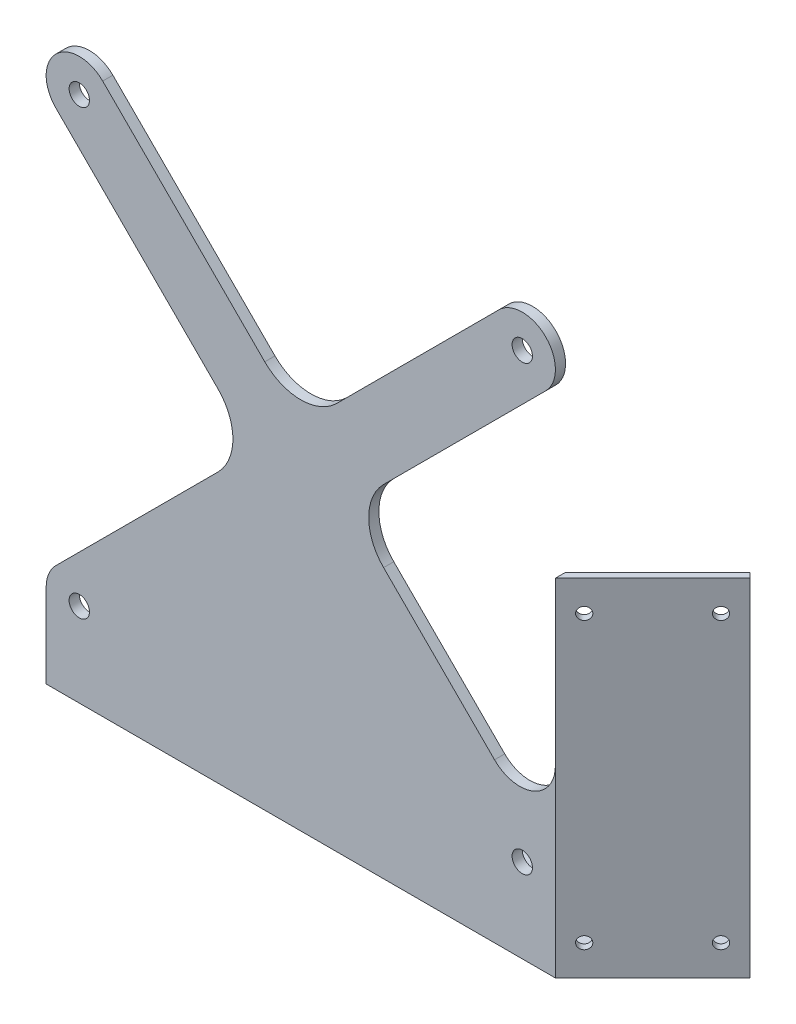
from build123d import *

# Parameters (mm, degrees)
ESQUISSE1_W                                 = 100
ESQUISSE1_H                                 = 110
BOSS_EXTRU_1_DEPTH                          = 2
ESQUISSE3_W                                 = 100
ESQUISSE3_H                                 = 20
BOSS_EXTRU_2_DEPTH                          = 3
ESQUISSE6_R                                 = 2
ENL_V_MAT_EXTRU_1_DEPTH                     = 78.517739905
ENL_V_MAT_EXTRU_2_DEPTH                     = 78.517739905
CONG_2_R                                    = 10
BOSS_EXTRU_3_DEPTH                          = 3
FRAISAGE_POUR_VIS_T_TE_FRAIS_E_M51_AT_COUNT = 2
FRAISAGE_POUR_VIS_T_TE_FRAIS_E_M51_AT_PITCH = 80
BOSS_EXTRU_4_DEPTH                          = 65
BOSS_EXTRU_5_DEPTH                          = 2
CONG_3_R                                    = 7
D_GAGEMENT_M21_D                            = 2.4
D_GAGEMENT_M21_ON_FACE_2_D                  = 2.4
CONG_1_R                                    = 2


with BuildPart() as part:
    # Esquisse1 → Boss.-Extru.1 (new body)
    with BuildSketch(Plane.XY):
        Rectangle(ESQUISSE1_W, ESQUISSE1_H)
    extrude(amount=BOSS_EXTRU_1_DEPTH)

    # Esquisse3 → Boss.-Extru.2 (add)
    with BuildSketch(Plane.XZ.offset(55)):
        with Locations((0, -10)):
            Rectangle(ESQUISSE3_W, ESQUISSE3_H)
    extrude(amount=-BOSS_EXTRU_2_DEPTH)

    # Esquisse6 → Enlèv. mat.-Extru.1 (cut, through all)
    with BuildSketch(Plane.XY.offset(2)):
        with Locations((-43.5, 48.5)):
            Circle(ESQUISSE6_R)
        with Locations((43.5, 48.5)):
            Circle(ESQUISSE6_R)
        with Locations((-43.5, -38.5)):
            Circle(ESQUISSE6_R)
        with Locations((43.5, -38.5)):
            Circle(ESQUISSE6_R)
    extrude(amount=-ENL_V_MAT_EXTRU_1_DEPTH, mode=Mode.SUBTRACT)

    # Esquisse7 → Enlèv. mat.-Extru.2 (cut, through all)
    with BuildSketch(Plane.XY.offset(2)):
        with BuildLine():
            Line((0, 55), (-43.500000007, 55))
            ThreePointArc((-43.500000007, 55), (-41.012557693, 54.505216963), (-38.903805922, 53.096194078))
            Line((-38.903805922, 53.096194078), (0, 14.192388155))
            Line((0, 14.192388155), (0, 55))
        make_face()
        with BuildLine():
            Line((-9.192388155, 5), (-48.096194078, 43.903805922))
            ThreePointArc((-48.096194078, 43.903805922), (-49.505216961, 46.01255769), (-50, 48.5))
            Line((-50, 48.5), (-50, -38.5))
            ThreePointArc((-50, -38.5), (-49.505216961, -36.01255769), (-48.096194078, -33.903805922))
            Line((-48.096194078, -33.903805922), (-9.192388155, 5))
        make_face()
        with BuildLine():
            Line((-50, 55), (-50, 48.5))
            ThreePointArc((-50, 48.5), (-48.09619408, 53.096194075), (-43.500000007, 55))
            Line((-43.500000007, 55), (-50, 55))
        make_face()
    enl_v_mat_extru_2 = extrude(amount=-ENL_V_MAT_EXTRU_2_DEPTH, mode=Mode.SUBTRACT)

    # Symétrie1: Enlèv. mat.-Extru.2 across plane
    add(enl_v_mat_extru_2.mirror(Plane(origin=(0, 0, 0), x_dir=(0, 0, 1), z_dir=(1, 0, 0))), mode=Mode.SUBTRACT)

    # Congé2
    cong_2_edges = [part.edges().sort_by_distance(p)[0] for p in [
        (9.192388155, 5, 1),
        (-9.192388155, 5, 1),
        (0, 14.192388155, 1),
    ]]
    fillet(cong_2_edges, radius=CONG_2_R)

    # Esquisse8 → Boss.-Extru.3 (add)
    with BuildSketch(Plane.XZ.offset(55)):
        Polygon((50, 2), (69.091883092, -17.091883092), (66.183766184, -20), (50, -20), align=None)
    extrude(amount=-BOSS_EXTRU_3_DEPTH)

    # Esquisse5 → Fraisage pour vis à tête fraisée M51 (revolve, cut)
    with BuildSketch(Plane(origin=(-33, -52, -12), x_dir=(0, 0, 1), z_dir=(1, 0, 0))):
        Polygon((0, 0), (0, 3), (2.75, 3), (2.75, 2.45), (5.2, 0), align=None)
    fraisage_pour_vis_t_te_frais_e_m51 = revolve(axis=Axis((-33, -45.65, -12), (0, -1, 0)), mode=Mode.SUBTRACT)

    # Fraisage pour vis à tête fraisée M51 at: Fraisage pour vis à tête fraisée M51 ×2
    with Locations(*[(i * FRAISAGE_POUR_VIS_T_TE_FRAIS_E_M51_AT_PITCH, 0, 0) for i in range(1, FRAISAGE_POUR_VIS_T_TE_FRAIS_E_M51_AT_COUNT)]):
        add(fraisage_pour_vis_t_te_frais_e_m51, mode=Mode.SUBTRACT)

    # Esquisse9 → Boss.-Extru.4 (add)
    with BuildSketch(Plane(origin=(0, -52, 0), x_dir=(1, 0, 0), z_dir=(0, 1, 0))):
        Polygon((50, -2), (69.091883092, 17.091883092), (68.091883092, 18.091883092), (50, 0), align=None)
    extrude(amount=BOSS_EXTRU_4_DEPTH)

    # Esquisse10 → Boss.-Extru.5 (add)
    with BuildSketch(Plane.XY.offset(2)):
        Polygon((48.096194078, -33.903805922), (50, -35.807611845), (50, -38.5), align=None)
    extrude(amount=-BOSS_EXTRU_5_DEPTH)

    # Congé3
    # the kernel refuses this fillet: 7 mm, written as the material it adds along each edge
    with BuildSketch(Plane(origin=(50, -35.807611845, 2), x_dir=(-0.707106781186548, 0.7071067811865469, 0), z_dir=(0, 0, -1))) as cong_3_piece_1_section:
        with BuildLine():
            CenterArc((CONG_3_R * 2.41421356237, CONG_3_R), CONG_3_R, 135, 135)
            Line((CONG_3_R * 1.70710678119, CONG_3_R * 1.70710678119), (0, 0))
            Line((0, 0), (CONG_3_R * 2.41421356237, 0))
        make_face()
    cong_3_piece_1 = extrude(amount=2, mode=Mode.PRIVATE)
    cong_3_piece_1 = split(cong_3_piece_1, bisect_by=Plane(origin=(49.112602223, -28.296939532, 0.887397777), z_dir=(0.7071067811865487, 0, 0.7071067811865464)), keep=Keep.TOP, mode=Mode.PRIVATE)
    cong_3_piece_1 = split(cong_3_piece_1, bisect_by=Plane(origin=(50.112602223, -28.296939532, 1.887397777), z_dir=(-0.7071067811865483, 0, -0.7071067811865467)), keep=Keep.TOP, mode=Mode.PRIVATE)
    add(cong_3_piece_1)
    with BuildSketch(Plane(origin=(50, -35.807611845, 2), x_dir=(-0.707106781186548, 0.7071067811865469, 0), z_dir=(0, 0, -1))) as cong_3_piece_2_section:
        with BuildLine():
            CenterArc((CONG_3_R * 2.41421356237, CONG_3_R), CONG_3_R, 135, 135)
            Line((CONG_3_R * 1.70710678119, CONG_3_R * 1.70710678119), (0, 0))
            Line((0, 0), (CONG_3_R * 2.41421356237, 0))
        make_face()
    cong_3_piece_2 = extrude(amount=2, mode=Mode.PRIVATE)
    cong_3_piece_2 = split(cong_3_piece_2, bisect_by=Plane(origin=(47.570771883, -28.332960354, 2.429228117), z_dir=(-0.7071067811865487, 0, -0.7071067811865464)), keep=Keep.TOP, mode=Mode.PRIVATE)
    add(cong_3_piece_2)

    # Dégagement M21 (through all)
    with Locations(Plane(origin=(52.828427125, 7, -0.828427125), x_dir=(-0.707106781187, 0, 0.707106781187), z_dir=(0.707106781187, 0, 0.707106781187))):
        with Locations((0, 0)):
            Hole(D_GAGEMENT_M21_D / 2)

    # Dégagement M21 on face 2 (through all)
    with Locations(Plane(origin=(66.263455967, 7, -14.263455967), x_dir=(0.707106781187, 0, -0.707106781187), z_dir=(0.707106781187, 0, 0.707106781187))):
        with Locations((0, 0), (0, -56), (-19, -56)):
            Hole(D_GAGEMENT_M21_ON_FACE_2_D / 2)

    # Congé1
    cong_1_edges = [part.edges().sort_by_distance(p)[0] for p in [
        (0, -52, 0),
        (59.045941546, -52, -9.045941546),
    ]]
    fillet(cong_1_edges, radius=CONG_1_R)


solid = part.part
